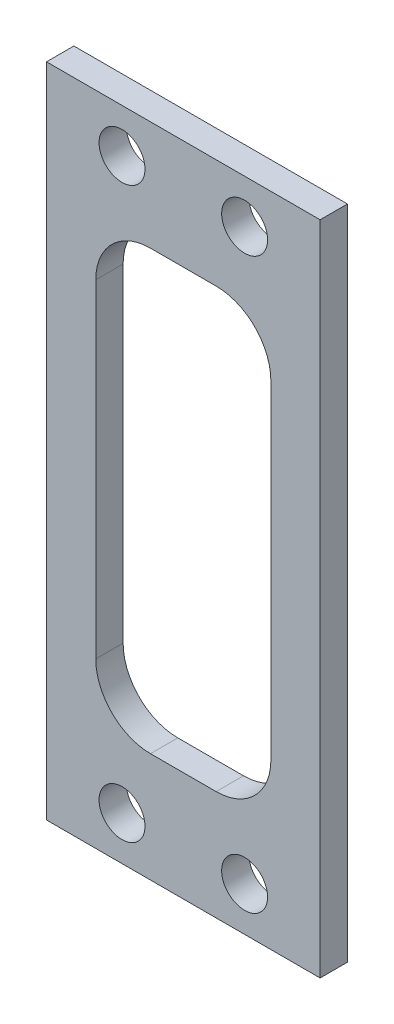
from build123d import *

# Parameters (mm, degrees)
SKETCH1_W               = 31.75
SKETCH1_H               = 76.2
SKETCH1_W_2             = 20.32
SKETCH1_H_2             = 50.8
BOSS_EXTRUDE1_DEPTH     = 3.175
FILLET1_R               = 6.35
CUT_EXTRUDE1_REACH      = 43.397
SKETCH2_R               = 2.665
MIRROR2_COPY_1_REACH    = 43.397
MIRROR2_COPY_1_SKETCH_R = 2.665
MIRROR2_COPY_2_REACH    = 43.397
MIRROR2_COPY_2_SKETCH_R = 2.665


with BuildPart() as part:
    # Sketch1 → Boss-Extrude1 (new body)
    with BuildSketch(Plane.XY):
        Rectangle(SKETCH1_W, SKETCH1_H)
        Rectangle(SKETCH1_W_2, SKETCH1_H_2, mode=Mode.SUBTRACT)
    extrude(amount=BOSS_EXTRUDE1_DEPTH)

    # Fillet1
    fillet1_edges = [part.edges().sort_by_distance(p)[0] for p in [
        (-10.16, 25.4, 1.5875),
        (10.16, 25.4, 1.5875),
        (-10.16, -25.4, 1.5875),
        (10.16, -25.4, 1.5875),
    ]]
    fillet(fillet1_edges, radius=FILLET1_R)

    # Sketch2 → Cut-Extrude1 (cut, up to next)
    with BuildSketch(Plane.XY.offset(3.175), mode=Mode.PRIVATE) as cut_extrude1_sk1:
        with Locations((7.112, -33.02)):
            Circle(SKETCH2_R)
    cut_extrude1_tool1 = extrude(cut_extrude1_sk1.sketch, amount=-CUT_EXTRUDE1_REACH, mode=Mode.PRIVATE) & part.part
    cut_extrude1 = cut_extrude1_tool1.solids().sort_by_distance((7.112, -33.02, 3.175))[0]
    add(cut_extrude1, mode=Mode.SUBTRACT)

    # Mirror1: Cut-Extrude1 across plane
    add(cut_extrude1.mirror(Plane(origin=(0, 0, 0), x_dir=(0, 0, 1), z_dir=(1, 0, 0))), mode=Mode.SUBTRACT)

    # Mirror2 copy 1 sketch → Mirror2 copy 1 (cut, up to next)
    with BuildSketch(Plane(origin=(0, 0, 3.175), x_dir=(-1, 0, 0), z_dir=(0, 0, 1)), mode=Mode.PRIVATE) as mirror2_copy_1_sk1:
        with Locations((7.112, -33.02)):
            Circle(MIRROR2_COPY_1_SKETCH_R)
    mirror2_copy_1_tool1 = extrude(mirror2_copy_1_sk1.sketch, amount=-MIRROR2_COPY_1_REACH, mode=Mode.PRIVATE) & part.part
    add(mirror2_copy_1_tool1.solids().sort_by_distance((-7.112, 33.02, 3.175))[0], mode=Mode.SUBTRACT)

    # Mirror2 copy 2 sketch → Mirror2 copy 2 (cut, up to next)
    with BuildSketch(Plane.XY.offset(3.175), mode=Mode.PRIVATE) as mirror2_copy_2_sk1:
        with Locations((7.112, 33.02)):
            Circle(MIRROR2_COPY_2_SKETCH_R)
    mirror2_copy_2_tool1 = extrude(mirror2_copy_2_sk1.sketch, amount=-MIRROR2_COPY_2_REACH, mode=Mode.PRIVATE) & part.part
    add(mirror2_copy_2_tool1.solids().sort_by_distance((7.112, 33.02, 3.175))[0], mode=Mode.SUBTRACT)


solid = part.part
